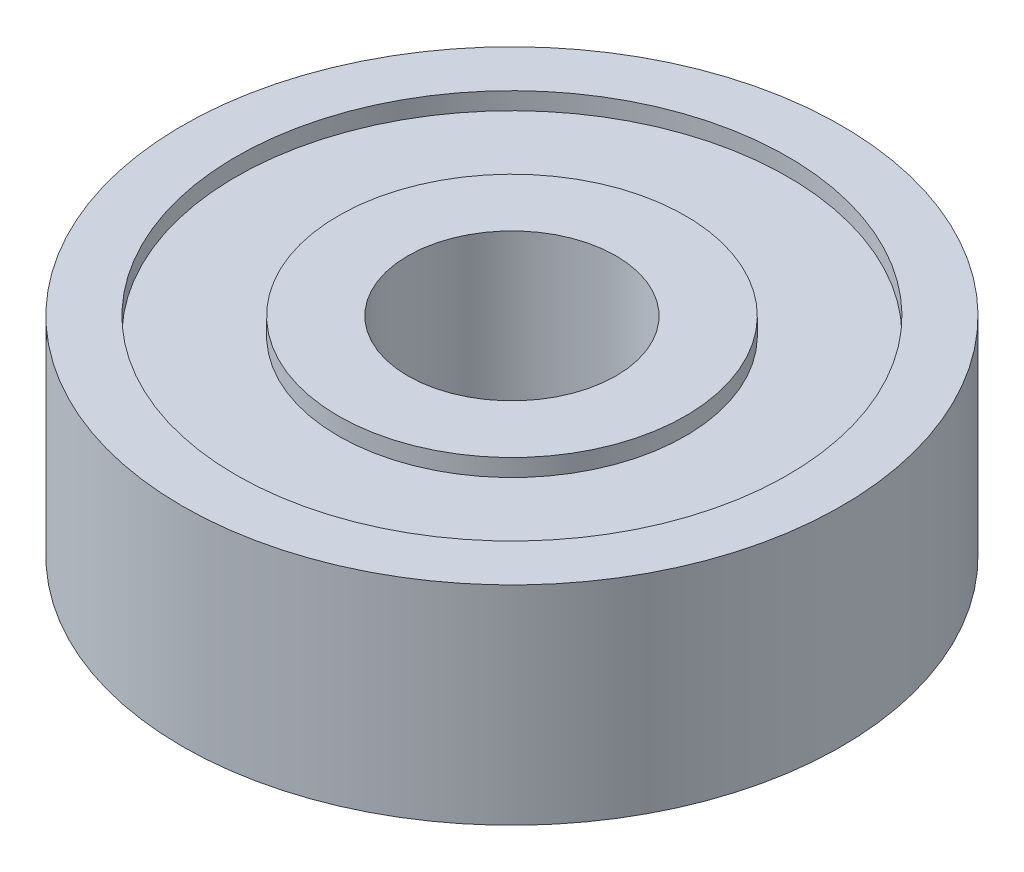
from build123d import *

# Parameters (mm, degrees)
SKETCH1_R           = 9.5
SKETCH1_R_2         = 3
BOSS_EXTRUDE1_DEPTH = 6
SKETCH2_R           = 7.95
SKETCH2_R_2         = 5.001453451
CUT_EXTRUDE1_DEPTH  = 0.5
CUT_EXTRUDE2_START  = -0.5
SKETCH3_R           = 7.95
SKETCH3_R_2         = 5.002476721
CUT_EXTRUDE2_DEPTH  = 0.5


with BuildPart() as part:
    # Sketch1 → Boss-Extrude1 (new body)
    with BuildSketch(Plane(origin=(0, 0, 0), x_dir=(1, 0, 0), z_dir=(0, 1, 0))):
        Circle(SKETCH1_R)
        Circle(SKETCH1_R_2, mode=Mode.SUBTRACT)
    extrude(amount=BOSS_EXTRUDE1_DEPTH)

    # Sketch2 → Cut-Extrude1 (cut)
    with BuildSketch(Plane(origin=(0, 6, 0), x_dir=(1, 0, 0), z_dir=(0, 1, 0))):
        Circle(SKETCH2_R)
        Circle(SKETCH2_R_2, mode=Mode.SUBTRACT)
    extrude(amount=-CUT_EXTRUDE1_DEPTH, mode=Mode.SUBTRACT)

    # Sketch3 → Cut-Extrude2 (cut)
    with BuildSketch(Plane.XZ.offset(CUT_EXTRUDE2_START)):
        Circle(SKETCH3_R)
        Circle(SKETCH3_R_2, mode=Mode.SUBTRACT)
    extrude(amount=CUT_EXTRUDE2_DEPTH, mode=Mode.SUBTRACT)


solid = part.part
